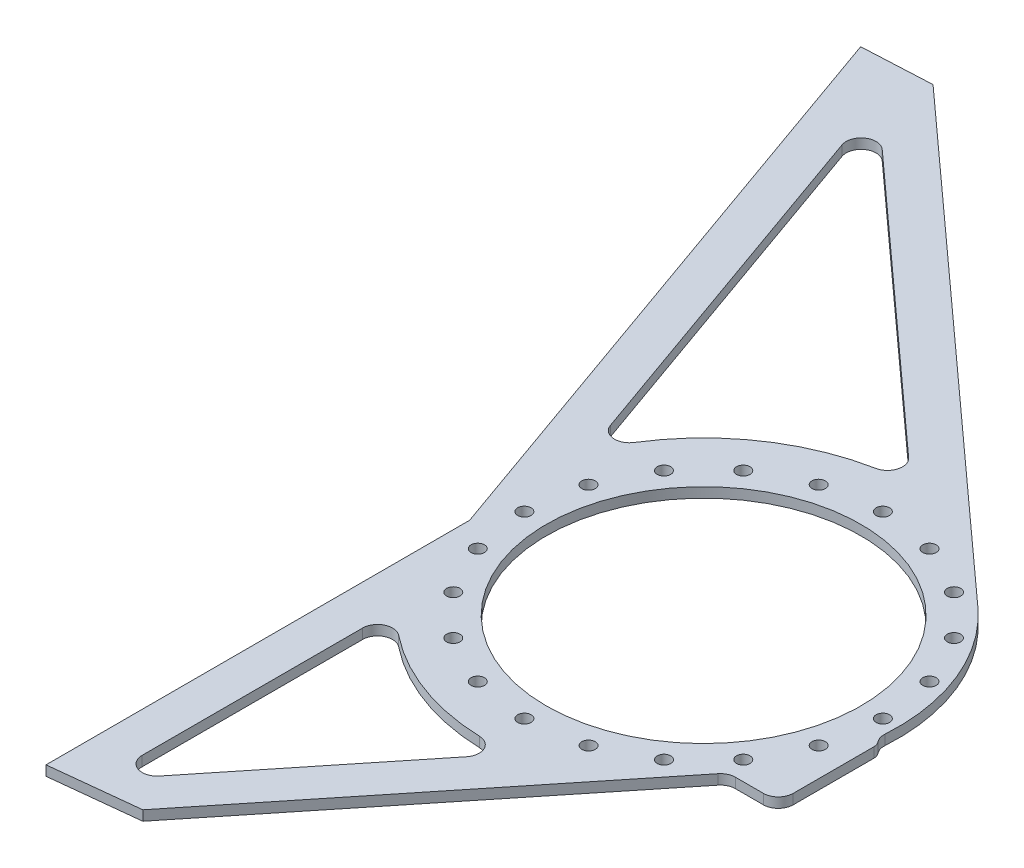
from build123d import *
from OCP.BRepFilletAPI import BRepFilletAPI_MakeChamfer

# Parameters (mm, degrees)
ESQUISSE2_R        = 6.75
ESQUISSE2_R_2      = 158
BOSS_EXTRU_1_DEPTH = 10
BOSS_EXTRU_2_DEPTH = 10
CONG_1_R           = 15
CHANFREIN1_SIZE    = 140
CHANFREIN1_SIZE2   = 99.577969333
CHANFREIN1_SIZE2_2 = 103.340011173
CONG_2_R           = 10


with BuildPart() as part:
    # Esquisse2 → Boss.-Extru.1 (new body)
    with BuildSketch(Plane(origin=(0, 0, 0), x_dir=(1, 0, 0), z_dir=(0, 1, 0))):
        with BuildLine():
            Line((0, 0), (0, 525))
            Line((0, 525), (-250, 1230.600775194))
            Line((-250, 1230.600775194), (330.895152108, 704.538780798))
            ThreePointArc((330.895152108, 704.538780798), (394.393669115, 575.365591696), (351.977546011, 437.820519282))
            Line((351.977546011, 437.820519282), (0, 0))
        make_face()
        with Locations(Location((200, 380, 0), (0, 0, 270))):
            Circle(ESQUISSE2_R, mode=Mode.SUBTRACT)
        with Locations(Location((144.376941013, 388.809827067, 0), (0, 0, 270))):
            Circle(ESQUISSE2_R, mode=Mode.SUBTRACT)
        with Locations(Location((94.198654587, 414.376941013, 0), (0, 0, 270))):
            Circle(ESQUISSE2_R, mode=Mode.SUBTRACT)
        with Locations(Location((54.376941013, 454.198654587, 0), (0, 0, 270))):
            Circle(ESQUISSE2_R, mode=Mode.SUBTRACT)
        with Locations(Location((28.809827067, 504.376941013, 0), (0, 0, 270))):
            Circle(ESQUISSE2_R, mode=Mode.SUBTRACT)
        with Locations(Location((20, 560, 0), (0, 0, 270))):
            Circle(ESQUISSE2_R, mode=Mode.SUBTRACT)
        with Locations(Location((28.809827067, 615.623058987, 0), (0, 0, 270))):
            Circle(ESQUISSE2_R, mode=Mode.SUBTRACT)
        with Locations(Location((54.376941013, 665.801345413, 0), (0, 0, 270))):
            Circle(ESQUISSE2_R, mode=Mode.SUBTRACT)
        with Locations(Location((94.198654587, 705.623058987, 0), (0, 0, 270))):
            Circle(ESQUISSE2_R, mode=Mode.SUBTRACT)
        with Locations(Location((144.376941013, 731.190172933, 0), (0, 0, 270))):
            Circle(ESQUISSE2_R, mode=Mode.SUBTRACT)
        with Locations(Location((200, 740, 0), (0, 0, 270))):
            Circle(ESQUISSE2_R, mode=Mode.SUBTRACT)
        with Locations(Location((255.623058987, 731.190172933, 0), (0, 0, 270))):
            Circle(ESQUISSE2_R, mode=Mode.SUBTRACT)
        with Locations(Location((305.801345413, 705.623058987, 0), (0, 0, 270))):
            Circle(ESQUISSE2_R, mode=Mode.SUBTRACT)
        with Locations(Location((345.623058987, 665.801345413, 0), (0, 0, 270))):
            Circle(ESQUISSE2_R, mode=Mode.SUBTRACT)
        with Locations(Location((371.190172933, 615.623058987, 0), (0, 0, 270))):
            Circle(ESQUISSE2_R, mode=Mode.SUBTRACT)
        with Locations(Location((380, 560, 0), (0, 0, 270))):
            Circle(ESQUISSE2_R, mode=Mode.SUBTRACT)
        with Locations(Location((371.190172933, 504.376941013, 0), (0, 0, 270))):
            Circle(ESQUISSE2_R, mode=Mode.SUBTRACT)
        with Locations(Location((345.623058987, 454.198654587, 0), (0, 0, 270))):
            Circle(ESQUISSE2_R, mode=Mode.SUBTRACT)
        with Locations(Location((305.801345413, 414.376941013, 0), (0, 0, 270))):
            Circle(ESQUISSE2_R, mode=Mode.SUBTRACT)
        with Locations(Location((255.623058987, 388.809827067, 0), (0, 0, 270))):
            Circle(ESQUISSE2_R, mode=Mode.SUBTRACT)
        with Locations(Location((200, 560, 0), (0, 0, 270))):
            Circle(ESQUISSE2_R_2, mode=Mode.SUBTRACT)
        with BuildLine():
            Line((40, 113.596012676), (40, 411.932447849))
            ThreePointArc((40, 411.932447849), (124.193302514, 355.604930059), (224.754658533, 343.410048984))
            Line((224.754658533, 343.410048984), (40, 113.596012676))
        make_face(mode=Mode.SUBTRACT)
        with BuildLine():
            Line((190.419715338, 777.789389424), (-159.36047406, 1094.552342888))
            Line((-159.36047406, 1094.552342888), (-0.382744379, 645.853105682))
            ThreePointArc((-0.382744379, 645.853105682), (76.012443637, 739.307238747), (190.419715338, 777.789389424))
        make_face(mode=Mode.SUBTRACT)
    extrude(amount=BOSS_EXTRU_1_DEPTH)

    # Esquisse4 → Boss.-Extru.2 (add)
    with BuildSketch(Plane(origin=(0, 10, 0), x_dir=(1, 0, 0), z_dir=(0, 1, 0))):
        Polygon((349.666295471, 435), (400, 435), (400, 535), (393.390796058, 535), align=None)
    extrude(amount=-BOSS_EXTRU_2_DEPTH)

    # Congé1
    # the kernel refuses this fillet: 15 mm, written as the material it adds along each edge
    with BuildSketch(Plane(origin=(40, 0, -113.596012676), x_dir=(0, 0, -1), z_dir=(0, 1, 0))) as cong_1_piece_1:
        with BuildLine():
            CenterArc((CONG_1_R * 2.83990031691, -CONG_1_R), CONG_1_R, 90, 141.203115043)
            Line((CONG_1_R * 2.21333887733, -CONG_1_R * 1.77937203082), (0, 0))
            Line((0, 0), (CONG_1_R * 2.83990031691, 0))
        make_face()
    extrude(amount=10)
    with BuildSketch(Plane(origin=(224.754658533, 0, -343.410048984), x_dir=(-0.9991751199955, 0, 0.040608860880086604), z_dir=(0, 1, 0))) as cong_1_piece_2:
        with BuildLine():
            CenterArc((32.974239643, 14.959854274), CONG_1_R, 138.875758739, 126.931398571)
            Line((21.674961702, 24.825264453), (0, 0))
            ThreePointArc((0, 0), (15.938767721, 0.58345122), (31.877535442, 0))
        make_face()
    extrude(amount=10)
    with BuildSketch(Plane(origin=(40, 0, -411.932447849), x_dir=(0.7331146005810171, 0, 0.6801051260025437), z_dir=(0, 1, 0))) as cong_1_piece_3:
        with BuildLine():
            CenterArc((34.335653812, -14.956465907), CONG_1_R, 94.366282627, 128.48557588)
            Line((23.338934803, -25.158042797), (0, 0))
            ThreePointArc((0, 0), (16.59683488, -0.632695485), (33.193669761, 0))
        make_face()
    extrude(amount=10)
    with BuildSketch(Plane(origin=(-0.382744379, 0, -645.853105682), x_dir=(0.4627745806888944, 0, -0.8864759937348659), z_dir=(0, 1, 0))) as cong_1_piece_4:
        with BuildLine():
            CenterArc((34.394590931, 14.956316108), CONG_1_R, 137.075935051, 128.550273023)
            Line((23.410737088, 25.1717434), (0, 0))
            ThreePointArc((0, 0), (16.625323332, 0.634872567), (33.250646665, 0))
        make_face()
    extrude(amount=10)
    with BuildSketch(Plane(origin=(190.419715338, 0, -777.789389424), x_dir=(-0.9931470305035408, 0, 0.11687162102922555), z_dir=(0, 1, 0))) as cong_1_piece_5:
        with BuildLine():
            CenterArc((32.974239643, -14.959854274), CONG_1_R, 94.19284269, 126.931398571)
            Line((21.674961702, -24.825264453), (0, 0))
            ThreePointArc((0, 0), (15.938767721, -0.58345122), (31.877535442, 0))
        make_face()
    extrude(amount=10)
    with BuildSketch(Plane(origin=(-159.36047406, 0, -1094.552342888), x_dir=(0.3339655112300271, 0, 0.942585294447599), z_dir=(0, 1, 0))) as cong_1_piece_6:
        with BuildLine():
            CenterArc((CONG_1_R * 3.96269318106, CONG_1_R), CONG_1_R, 118.326186848, 151.673813152)
            Line((CONG_1_R * 3.48820260226, CONG_1_R * 1.88026058109), (0, 0))
            Line((0, 0), (CONG_1_R * 3.96269318106, 0))
        make_face()
    extrude(amount=10)
    with BuildSketch(Plane(origin=(393.390796058, 10, -535), x_dir=(1, 0, 0), z_dir=(0, -1, 0))) as cong_1_piece_7:
        with BuildLine():
            CenterArc((16.178133023, -11.551432649), CONG_1_R, 129.637533665, 54.034246436)
            ThreePointArc((1.208923803, -12.512044602), (0.705308812, -6.246278392), (0, 0))
            Line((0, 0), (6.609203942, 0))
        make_face()
    extrude(amount=10)
    with BuildSketch(Plane(origin=(349.71004275, 10, -435), x_dir=(1, 0, 0), z_dir=(0, -1, 0))) as cong_1_piece_8:
        with BuildLine():
            CenterArc((CONG_1_R * 0.479153145931, CONG_1_R), CONG_1_R, 218.796884957, 51.203115043)
            Line((-CONG_1_R * 0.300218884894, CONG_1_R * 0.37343856042), (0, 0))
            Line((0, 0), (CONG_1_R * 0.479153145931, 0))
        make_face()
    extrude(amount=10)
    # the kernel refuses this fillet: 15 mm, written as the material it takes off along each edge
    with BuildSketch(Plane(origin=(400, 47.5, -435), x_dir=(0, 0, -1), z_dir=(0, -1, 0))) as cong_1_2_piece_1:
        with BuildLine():
            CenterArc((CONG_1_R, -CONG_1_R), CONG_1_R, 90, 90)
            Line((0, -CONG_1_R), (0, 0))
            Line((0, 0), (CONG_1_R, 0))
        make_face()
    extrude(amount=85, mode=Mode.SUBTRACT)

    # Chanfrein1: one chamfer whose edges measure the first distance from different faces: ONE call of the kernel's chamfer builder (chamfer() names one face for all edges)
    chanfrein1_edges_1 = [part.edges().sort_by_distance(p)[0] for p in [
        (0, 5, 0),
    ]]
    chanfrein1_side_1 = [part.faces().sort_by_distance(p)[0] for p in [
        (172.603379738, 5, -214.699210797),
    ]]
    chanfrein1_edges_2 = [part.edges().sort_by_distance(p)[0] for p in [
        (-250, 5, -1230.600775194),
    ]]
    chanfrein1_side_2 = [part.faces().sort_by_distance(p)[0] for p in [
        (40.447576054, 5, -967.569777996),
    ]]
    chanfrein1 = BRepFilletAPI_MakeChamfer(part.part.solid().wrapped)
    for e in chanfrein1_edges_1:
        chanfrein1.Add(CHANFREIN1_SIZE, CHANFREIN1_SIZE2, e.wrapped, chanfrein1_side_1[0].wrapped)  # the first distance lies on this face
    for e in chanfrein1_edges_2:
        chanfrein1.Add(CHANFREIN1_SIZE, CHANFREIN1_SIZE2_2, e.wrapped, chanfrein1_side_2[0].wrapped)  # the first distance lies on this face
    add(Compound.cast(chanfrein1.Shape()), mode=Mode.REPLACE)

    # Congé2
    cong_2_edges = [part.edges().sort_by_distance(p)[0] for p in [
        (400, 5, -535),
    ]]
    fillet(cong_2_edges, radius=CONG_2_R)


solid = part.part
